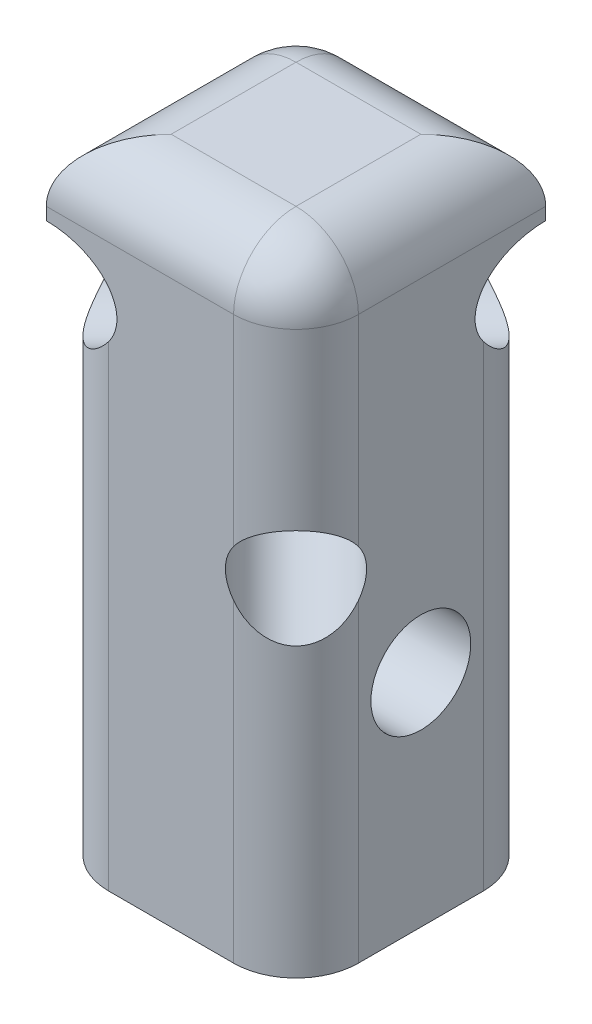
from build123d import *

# Parameters (mm, degrees)
SKETCH1_W           = 6
SKETCH1_H           = 6
BOSS_EXTRUDE1_DEPTH = 15
SKETCH2_R           = 1.2
CUT_EXTRUDE1_DEPTH  = 15
SKETCH3_R           = 1.2
CUT_EXTRUDE3_DEPTH  = 15
SKETCH4_R           = 1.2
CUT_EXTRUDE5_DEPTH  = 15
FILLET1_R           = 1.5


with BuildPart() as part:
    # Sketch1 → Boss-Extrude1 (new body)
    with BuildSketch(Plane(origin=(0, 0, 0), x_dir=(1, 0, 0), z_dir=(0, 1, 0))):
        Rectangle(SKETCH1_W, SKETCH1_H)
    extrude(amount=BOSS_EXTRUDE1_DEPTH)

    # Sketch2 → Cut-Extrude1 (cut)
    with BuildSketch(Plane.ZY.offset(3)):
        with Locations((0, 5.3)):
            Circle(SKETCH2_R)
    extrude(amount=-CUT_EXTRUDE1_DEPTH, mode=Mode.SUBTRACT)

    # Sketch3 → Cut-Extrude3 (cut)
    with BuildSketch(Plane(origin=(3, 0, 3), x_dir=(0.7071067811865476, 0, -0.7071067811865476), z_dir=(0.7071067811865476, 0, 0.7071067811865476))):
        with Locations((0, 8.11)):
            Circle(SKETCH3_R)
    extrude(amount=-CUT_EXTRUDE3_DEPTH, mode=Mode.SUBTRACT)

    # Sketch4 → Cut-Extrude5 (cut)
    with BuildSketch(Plane(origin=(-3, 0, 3), x_dir=(0.7071067811865476, 0, 0.7071067811865476), z_dir=(-0.7071067811865476, 0, 0.7071067811865476))):
        with Locations((0, 12)):
            Circle(SKETCH4_R)
    extrude(amount=-CUT_EXTRUDE5_DEPTH, mode=Mode.SUBTRACT)

    # Fillet1
    fillet1_edges = [part.edges().sort_by_distance(p)[0] for p in [
        (0, 15, 3),
        (-3, 15, 0),
        (0, 15, -3),
        (3, 15, 0),
        (3, 12.155, 3),
        (-3, 5.4, 3),
        (3, 3.455, 3),
        (3, 5.4, -3),
        (-3, 12.155, -3),
        (-3, 3.455, -3),
    ]]
    fillet(fillet1_edges, radius=FILLET1_R)


solid = part.part
